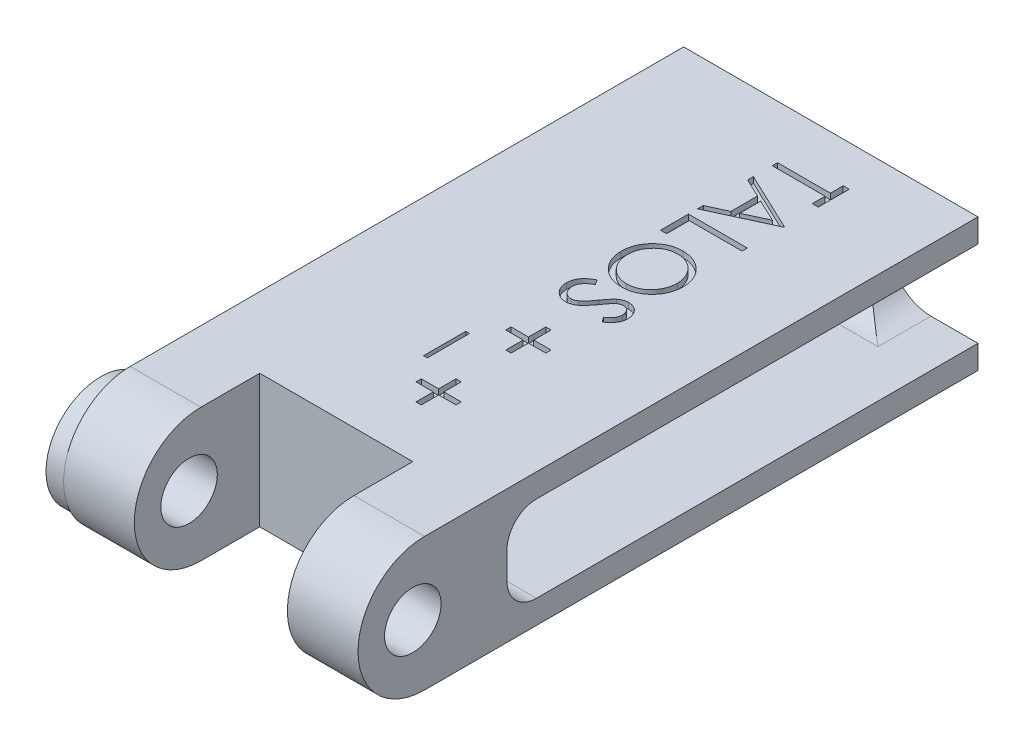
from build123d import *

# Parameters (mm, degrees)
SKETCH1_W           = 20
SKETCH1_H           = 14.6
SKETCH1_R           = 1.65
BOSS_EXTRUDE1_DEPTH = 4
SKETCH2_W           = 50
SKETCH2_H           = 80
BOSS_EXTRUDE2_DEPTH = 4
CHAMFER1_SIZE       = 10
MIRROR1_OUTLINE_W   = 50
MIRROR1_OUTLINE_H   = 4
MIRROR1_DEPTH       = 80
MIRROR1_2_DEPTH     = 4
SKETCH3_W           = 50
SKETCH3_H           = 22.6
BOSS_EXTRUDE3_DEPTH = 4
SKETCH7_R           = 4.8
BOSS_EXTRUDE5_DEPTH = 12
SKETCH8_R           = 9.3
BOSS_EXTRUDE6_DEPTH = 3
SKETCH9_R           = 2.4
BOSS_EXTRUDE7_DEPTH = 4.2
CUT_EXTRUDE2_DEPTH  = 12
FILLET1_R           = 7
FILLET2_R           = 5
FILLET3_R           = 5
SKETCH12_W          = 0.641025641
SKETCH12_H          = 7.17948718
CUT_EXTRUDE3_DEPTH  = 1


# Read off the part's stored shape, not the designer's step: Mirror1
with BuildPart() as part:
    # Sketch1 → Boss-Extrude1 (new body)
    with BuildSketch(Plane.XY):
        Rectangle(SKETCH1_W, SKETCH1_H)
        with Locations((-6, 0)):
            Circle(SKETCH1_R, mode=Mode.SUBTRACT)
        with Locations((6, 0)):
            Circle(SKETCH1_R, mode=Mode.SUBTRACT)
    extrude(amount=BOSS_EXTRUDE1_DEPTH)

    # Sketch2 → Boss-Extrude2 (add)
    with BuildSketch(Plane.XZ.offset(7.3)):
        with Locations((0, 40)):
            Rectangle(SKETCH2_W, SKETCH2_H)
    extrude(amount=BOSS_EXTRUDE2_DEPTH)

    # Chamfer1
    chamfer1_edges = [part.edges().sort_by_distance(p)[0] for p in [
        (10, -7.3, 2),
        (-10, -7.3, 2),
    ]]
    chamfer(chamfer1_edges, length=CHAMFER1_SIZE)

    # Mirror1 outline → Mirror1 (add)
    with BuildSketch(Plane.XY):
        with Locations((0, 9.3)):
            Rectangle(MIRROR1_OUTLINE_W, MIRROR1_OUTLINE_H)
    extrude(amount=MIRROR1_DEPTH)

    # Mirror1 2 outline → Mirror1 2 (add)
    with BuildSketch(Plane.XY):
        Polygon((-10, 7.3), (-20, 7.3), (-12.7, 0), (-10, 2.7), align=None)
        Polygon((12.7, 0), (20, 7.3), (10, 7.3), (10, 2.7), align=None)
    extrude(amount=MIRROR1_2_DEPTH)

    # Sketch3 → Boss-Extrude3 (add)
    with BuildSketch(Plane.XY.offset(80)):
        Rectangle(SKETCH3_W, SKETCH3_H)
    extrude(amount=BOSS_EXTRUDE3_DEPTH)

    # Sketch7 → Boss-Extrude5 (add)
    with BuildSketch(Plane(origin=(25, 0, 0), x_dir=(0, 0, -1), z_dir=(1, 0, 0))):
        with BuildLine():
            Line((-84, 11.3), (-94, 11.3))
            ThreePointArc((-94, 11.3), (-105.3, 0), (-94, -11.3))
            Line((-94, -11.3), (-84, -11.3))
            Line((-84, -11.3), (-84, 11.3))
        make_face()
        with Locations((-96, 0)):
            Circle(SKETCH7_R, mode=Mode.SUBTRACT)
    boss_extrude5 = extrude(amount=-BOSS_EXTRUDE5_DEPTH)

    # Mirror2: Boss-Extrude5 across plane
    add(boss_extrude5.mirror(Plane(origin=(0, 0, 0), x_dir=(0, 0, 1), z_dir=(1, 0, 0))))

    # Sketch8 → Boss-Extrude6 (add)
    with BuildSketch(Plane.ZY.offset(25)):
        with Locations(Location((96, 0, 0), (0, 0, 359.999368251))):
            Circle(SKETCH8_R)
    extrude(amount=BOSS_EXTRUDE6_DEPTH)

    # Sketch9 → Boss-Extrude7 (add)
    with BuildSketch(Plane.ZY.offset(28)):
        with Locations((96, 0)):
            Circle(SKETCH9_R)
    extrude(amount=BOSS_EXTRUDE7_DEPTH)

    # Sketch11 → Cut-Extrude2 (cut)
    with BuildSketch(Plane(origin=(0, 0, 0), x_dir=(-1, 0, 0), z_dir=(0, 0, -1))):
        Polygon((-10, -7.3), (-10, 7.3), (-20, 7.3), (-12.7, 0), (-20, -7.3), align=None)
        Polygon((20, 7.3), (10, 7.3), (10, -7.3), (20, -7.3), (12.7, 0), align=None)
    extrude(amount=-CUT_EXTRUDE2_DEPTH, mode=Mode.SUBTRACT)

    # Fillet1
    fillet1_edges = [part.edges().sort_by_distance(p)[0] for p in [
        (10, 7.3, 2),
        (10, -7.3, 2),
        (-10, 7.3, 2),
        (-10, -7.3, 2),
    ]]
    fillet(fillet1_edges, radius=FILLET1_R)

    # Fillet2
    fillet2_edges = [part.edges().sort_by_distance(p)[0] for p in [
        (0, 7.3, 4),
        (0, -7.3, 4),
    ]]
    fillet(fillet2_edges, radius=FILLET2_R)

    # Fillet3
    fillet3_edges = [part.edges().sort_by_distance(p)[0] for p in [
        (0, -7.3, 80),
        (0, 7.3, 80),
    ]]
    fillet(fillet3_edges, radius=FILLET3_R)

    # Sketch12 → Cut-Extrude3 (cut)
    # profile 1 of 8: a face of its own
    with BuildSketch(Plane(origin=(0, 11.3, 0), x_dir=(1, 0, 0), z_dir=(0, 1, 0))):
        Polygon((8.974358974, -6.869589227), (10, -6.869589227), (10, -12.125999483), (8.974358974, -12.125999483), (8.974358974, -9.946512304), (0, -9.946512304), (0, -9.049076406), (8.974358974, -9.049076406), align=None)
    # profile 2 of 8: a face of its own
    with BuildSketch(Plane(origin=(0, 11.3, 0), x_dir=(1, 0, 0), z_dir=(0, 1, 0))):
        Polygon((10, -18.023435381), (0, -22.638819996), (0, -21.663259099), (3.205128205, -20.184893714), (3.205128205, -15.651640509), (0, -14.133211022), (0, -13.151640509), (10, -17.895230252), align=None)
        Polygon((8.048878205, -17.949316791), (4.230769231, -16.14042256), (4.230769231, -19.712137304), align=None, mode=Mode.SUBTRACT)
    # profile 3 of 8: a face of its own
    with BuildSketch(Plane(origin=(0, 11.3, 0), x_dir=(1, 0, 0), z_dir=(0, 1, 0))):
        Polygon((10, -24.177281535), (10, -25.074717432), (1.025641026, -25.074717432), (1.025641026, -28.920871278), (0, -28.920871278), (0, -24.177281535), align=None)
    # profile 4 of 8: a face of its own
    with BuildSketch(Plane(origin=(0, 11.3, 0), x_dir=(1, 0, 0), z_dir=(0, 1, 0))):
        with BuildLine():
            add(Edge.make_bspline(
                [(10.256410256, -35.267025124), (10.251720273, -35.452191104), (10.242508758, -35.815872365), (10.17199764, -36.350372602), (10.050008587, -36.860642363), (9.887551039, -37.350849835), (9.670794245, -37.815089351), (9.408949056, -38.257012712), (9.098291416, -38.675370431), (8.744034019, -39.066327757), (8.357182497, -39.422777414), (7.943152065, -39.734205023), (7.507612223, -39.997514714), (7.049047409, -40.213331205), (6.569475928, -40.382794384), (6.066171026, -40.499695417), (5.542439743, -40.574378721), (5.185219838, -40.583109118), (5.00400641, -40.587537945)],
                knots=[0, 0, 0, 0, 1.06508495, 2.091914715, 3.094501328, 4.079693967, 5.057647778, 6.035986298, 7.030177474, 8.050107388, 9.066943579, 10.051896531, 11.025616101, 11.9896488, 12.96281505, 13.945825876, 14.957941789, 16, 16, 16, 16], degree=3))
            add(Edge.make_bspline(
                [(5.00400641, -40.587537945), (4.824127837, -40.583109774), (4.46956633, -40.574381337), (3.949158714, -40.499610417), (3.448891415, -40.382361374), (2.969648141, -40.21490319), (2.510743141, -40.000123482), (2.074402732, -39.735034201), (1.657505512, -39.425668444), (1.268776002, -39.070450824), (0.911626105, -38.683691556), (0.599714309, -38.268493588), (0.333162649, -37.833382382), (0.118826425, -37.375094779), (-0.051836088, -36.898739926), (-0.168303261, -36.399952048), (-0.243400628, -35.880956782), (-0.252026128, -35.527040333), (-0.256410256, -35.347153329)],
                knots=[0, 0, 0, 0, 1.04355943, 2.056976533, 3.044937463, 4.02179873, 4.997890911, 5.980248884, 6.980147982, 8.006253959, 9.032111064, 10.031228745, 11.015595249, 11.988180414, 12.962670953, 13.946861971, 14.95644057, 16, 16, 16, 16], degree=3))
            add(Edge.make_bspline(
                [(-0.256410256, -35.347153329), (-0.251984031, -35.165940635), (-0.243258762, -34.808722177), (-0.16844623, -34.284335728), (-0.051502314, -33.7806664), (0.115781777, -33.299264982), (0.331162929, -32.8399735), (0.59583438, -32.402836374), (0.907713335, -31.987328314), (1.262458028, -31.597677596), (1.649403169, -31.241589515), (2.061872021, -30.928389484), (2.495941769, -30.66524392), (2.949823096, -30.449771846), (3.422342797, -30.279341639), (3.916473197, -30.163031388), (4.429445413, -30.087788733), (4.778710535, -30.079117341), (4.955929487, -30.074717432)],
                knots=[0, 0, 0, 0, 1.053167129, 2.076072758, 3.073341244, 4.055601477, 5.033424535, 6.017524495, 7.021518915, 8.049444456, 9.077120685, 10.074910483, 11.055688766, 12.022980584, 12.991883888, 13.970269434, 14.970104079, 16, 16, 16, 16], degree=3))
            add(Edge.make_bspline(
                [(4.955929487, -30.074717432), (5.074880514, -30.076243561), (5.311281947, -30.079276567), (5.662321377, -30.115844869), (6.007753236, -30.16880106), (6.346416349, -30.245092575), (6.678366018, -30.343502158), (7.002923388, -30.464775273), (7.322761859, -30.60375431), (7.631794336, -30.769228051), (7.930505869, -30.949764855), (8.215161318, -31.1466221), (8.480675968, -31.361172367), (8.731316214, -31.590350856), (8.962804196, -31.837329911), (9.180186887, -32.098392504), (9.38121402, -32.374904633), (9.561663472, -32.66730361), (9.727408486, -32.968134611), (9.865791933, -33.27958018), (9.988104342, -33.595069129), (10.085306436, -33.917380408), (10.162660442, -34.245768458), (10.215220535, -34.580643799), (10.25187009, -34.921661515), (10.254890356, -35.151408613), (10.256410256, -35.267025124)],
                knots=[0, 0, 0, 0, 1.037115869, 2.061148057, 3.07517727, 4.084041727, 5.086514338, 6.092668487, 7.104487461, 8.125783165, 9.147610153, 10.147694368, 11.141876323, 12.122903372, 13.107606018, 14.091946891, 15.084523921, 16.086505767, 17.087268121, 18.077809654, 19.05670789, 20.036870126, 21.011670792, 21.99694167, 22.991993299, 24, 24, 24, 24], degree=3))
        make_face()
        with BuildLine():
            add(Edge.make_bspline(
                [(9.230769231, -35.311095637), (9.229612952, -35.216196467), (9.227311449, -35.027305371), (9.196972691, -34.746495613), (9.153775095, -34.469363743), (9.091999222, -34.195924841), (9.008604034, -33.927650388), (8.910340594, -33.661861298), (8.794748549, -33.399833798), (8.659965346, -33.144497168), (8.512729335, -32.896278204), (8.351132709, -32.660449536), (8.175959042, -32.439363715), (7.989522262, -32.232312523), (7.789925445, -32.039899303), (7.580354173, -31.85822371), (7.354775423, -31.694597687), (7.119317636, -31.544638531), (6.874284408, -31.410444799), (6.622256267, -31.291115188), (6.361177152, -31.193503741), (6.093879562, -31.11389695), (5.820786819, -31.047897491), (5.539827251, -31.006086279), (5.252412645, -30.975422395), (5.058178777, -30.973251408), (4.959935897, -30.972153329)],
                knots=[0, 0, 0, 0, 1.008585988, 2.007529826, 2.999688727, 3.990042337, 4.984966365, 5.984641633, 7.001812546, 8.027570247, 9.052811818, 10.068991095, 11.064725446, 12.050001529, 13.029093193, 14.010961114, 14.996492974, 15.989185205, 16.977398719, 17.96520407, 18.951579521, 19.937648295, 20.929603947, 21.935788061, 22.955928099, 24, 24, 24, 24], degree=3))
            add(Edge.make_bspline(
                [(4.959935897, -30.972153329), (4.815472409, -30.975795792), (4.531268037, -30.982961643), (4.114787626, -31.045697558), (3.714535379, -31.14233177), (3.332701353, -31.284781389), (2.966003402, -31.462926002), (2.617694531, -31.683002832), (2.287680605, -31.943743076), (1.97826555, -32.239924581), (1.695848967, -32.563703742), (1.447953514, -32.907511542), (1.238209943, -33.267664706), (1.067338307, -33.645102428), (0.931939056, -34.037809683), (0.839142968, -34.448316971), (0.778070238, -34.873889713), (0.772205221, -35.163977299), (0.769230769, -35.311095637)],
                knots=[0, 0, 0, 0, 1.032063989, 2.030389145, 3.003944642, 3.970395727, 4.937377036, 5.913328081, 6.909231446, 7.93887556, 8.970685674, 9.976071282, 10.964166581, 11.944589148, 12.933237628, 13.927779006, 14.949070134, 16, 16, 16, 16], degree=3))
            add(Edge.make_bspline(
                [(0.769230769, -35.311095637), (0.770589349, -35.40997993), (0.773283821, -35.606097183), (0.800422957, -35.897798634), (0.843942363, -36.184245108), (0.906602193, -36.465033906), (0.985019773, -36.739849772), (1.078195918, -37.009827032), (1.19438572, -37.27213758), (1.322967657, -37.529910728), (1.468497551, -37.776695799), (1.627835379, -38.010834865), (1.799876257, -38.230970527), (1.984694048, -38.437579584), (2.180695571, -38.631326012), (2.39292035, -38.806948782), (2.615170446, -38.972535019), (2.851177439, -39.121893722), (3.096727022, -39.255820653), (3.349709813, -39.372278425), (3.609256397, -39.471138823), (3.875806673, -39.550930685), (4.148836878, -39.613461619), (4.428717316, -39.656546821), (4.714886808, -39.686685294), (4.908440691, -39.688956933), (5.006009615, -39.690102047)],
                knots=[0, 0, 0, 0, 1.047226202, 2.076964084, 3.100341814, 4.114585567, 5.122123135, 6.126552355, 7.137064942, 8.158803602, 9.176592812, 10.169297945, 11.156925011, 12.133779169, 13.104132798, 14.073170763, 15.049307625, 16.038276215, 17.028988595, 18.010110019, 18.986169996, 19.968539974, 20.955178716, 21.950601663, 22.966915103, 24, 24, 24, 24], degree=3))
            add(Edge.make_bspline(
                [(5.006009615, -39.690102047), (5.102911056, -39.68895601), (5.295132914, -39.686682635), (5.579306681, -39.656561279), (5.857172999, -39.613415877), (6.127641008, -39.551236712), (6.390779651, -39.471093415), (6.646341787, -39.372272471), (6.895279487, -39.255743044), (7.136977478, -39.12200526), (7.368905302, -38.971674336), (7.590626479, -38.807405069), (7.797977175, -38.626361219), (7.996076274, -38.433715426), (8.180698919, -38.224655783), (8.351905726, -38.000129116), (8.513830873, -37.762861896), (8.659898137, -37.511639572), (8.794817546, -37.252377315), (8.910312287, -36.986314667), (9.009029008, -36.715999598), (9.091657869, -36.442816108), (9.153835618, -36.164839729), (9.196957192, -35.883689235), (9.227314698, -35.598884068), (9.229614066, -35.407329531), (9.230769231, -35.311095637)],
                knots=[0, 0, 0, 0, 1.029967493, 2.04313025, 3.035375922, 4.01889446, 4.991458755, 5.958017022, 6.930036849, 7.912118993, 8.892942568, 9.867138445, 10.843712051, 11.817804417, 12.803729339, 13.806387533, 14.818654169, 15.856205545, 16.894655496, 17.924916651, 18.938004761, 19.953404357, 20.957695443, 21.963967554, 22.97713031, 24, 24, 24, 24], degree=3))
        make_face(mode=Mode.SUBTRACT)
    # profile 5 of 8: a face of its own
    with BuildSketch(Plane(origin=(0, 11.3, 0), x_dir=(1, 0, 0), z_dir=(0, 1, 0))):
        with BuildLine():
            Line((1.929086538, -41.61317897), (2.435897436, -42.458531535))
            add(Edge.make_bspline(
                [(2.435897436, -42.458531535), (2.304284907, -42.53715507), (2.052120382, -42.687794728), (1.711383124, -42.939084326), (1.421776961, -43.199464072), (1.184986654, -43.470862168), (0.998561264, -43.75162202), (0.866554887, -44.043576459), (0.784223529, -44.345741633), (0.774223282, -44.551381122), (0.769230769, -44.654044355)],
                knots=[0, 0, 0, 0, 1.272034388, 2.437168799, 3.508375237, 4.49857839, 5.41946034, 6.295179144, 7.148887113, 8, 8, 8, 8], degree=3))
            add(Edge.make_bspline(
                [(0.769230769, -44.654044355), (0.771672688, -44.741721108), (0.776513797, -44.915540478), (0.823030419, -45.171432468), (0.894493475, -45.419952403), (0.996839627, -45.65597521), (1.120661585, -45.876255158), (1.270230127, -46.069393375), (1.437647918, -46.23646662), (1.624559192, -46.37275732), (1.8248818, -46.478560674), (2.032342831, -46.555122909), (2.246029729, -46.603850166), (2.390902996, -46.610052169), (2.463942308, -46.61317897)],
                knots=[0, 0, 0, 0, 1.095270387, 2.171376115, 3.241375676, 4.322296363, 5.380636668, 6.392615365, 7.366724986, 8.328592944, 9.273498763, 10.190095884, 11.087518669, 12, 12, 12, 12], degree=3))
            add(Edge.make_bspline(
                [(2.463942308, -46.61317897), (2.547201878, -46.608966654), (2.716456419, -46.600403631), (2.966169713, -46.528027973), (3.213291342, -46.414172982), (3.3661521, -46.309136857), (3.445512821, -46.254605252)],
                knots=[0, 0, 0, 0, 0.938893495, 1.908633276, 2.914225137, 4, 4, 4, 4], degree=3))
            add(Edge.make_bspline(
                [(3.445512821, -46.254605252), (3.502906547, -46.209958821), (3.623751181, -46.115954091), (3.800623953, -45.952106412), (3.98752636, -45.76484435), (4.183699434, -45.553231733), (4.385560567, -45.31306214), (4.597317573, -45.049267163), (4.818334044, -44.760481243), (4.964490078, -44.556957977), (5.040064103, -44.451720637)],
                knots=[0, 0, 0, 0, 0.72226686, 1.520759855, 2.393439377, 3.351307446, 4.386958158, 5.510256019, 6.712608938, 8, 8, 8, 8], degree=3))
            add(Edge.make_bspline(
                [(5.040064103, -44.451720637), (5.115020077, -44.346523253), (5.258330192, -44.145393867), (5.470749255, -43.863902198), (5.666198263, -43.61252417), (5.841954683, -43.389978886), (6.005684121, -43.202023874), (6.148611593, -43.041788025), (6.278369262, -42.915183046), (6.362477748, -42.844730361), (6.400240385, -42.813098842)],
                knots=[0, 0, 0, 0, 1.452255772, 2.776602448, 3.96446981, 5.032613149, 5.964194703, 6.766668629, 7.446264616, 8, 8, 8, 8], degree=3))
            add(Edge.make_bspline(
                [(6.400240385, -42.813098842), (6.45910049, -42.76889157), (6.574856786, -42.681952037), (6.755784951, -42.567192021), (6.940994281, -42.469651556), (7.130982466, -42.39318775), (7.323082262, -42.328798553), (7.519800107, -42.28549018), (7.720253303, -42.258371903), (7.855149019, -42.255594798), (7.922676282, -42.254204611)],
                knots=[0, 0, 0, 0, 1.068054152, 2.10047183, 3.106115577, 4.101338837, 5.06977816, 6.043150881, 7.020423561, 8, 8, 8, 8], degree=3))
            add(Edge.make_bspline(
                [(7.922676282, -42.254204611), (8.028484496, -42.257917513), (8.237839349, -42.265263955), (8.543513198, -42.327901445), (8.836240705, -42.425611789), (9.109573973, -42.566929555), (9.362873811, -42.74165064), (9.59227021, -42.948143517), (9.786758581, -43.193308356), (9.954716197, -43.463801452), (10.087325758, -43.757966301), (10.187890317, -44.065663395), (10.244112064, -44.388241998), (10.25227058, -44.607098102), (10.256410256, -44.718146919)],
                knots=[0, 0, 0, 0, 1.005541892, 1.989591032, 2.955705311, 3.932863626, 4.905387107, 5.876519979, 6.856563935, 7.871847665, 8.897921447, 9.918317993, 10.943742853, 12, 12, 12, 12], degree=3))
            add(Edge.make_bspline(
                [(10.256410256, -44.718146919), (10.252421961, -44.836004771), (10.244512693, -45.069730985), (10.173281219, -45.414176834), (10.058219835, -45.746444752), (9.925697029, -46.013904145), (9.793931624, -46.222867363), (9.673866426, -46.382215266), (9.535654372, -46.543694517), (9.378912918, -46.708603003), (9.202208136, -46.874147815), (9.00674896, -47.042786229), (8.793730248, -47.214912718), (8.641660243, -47.325643746), (8.563701923, -47.38240974)],
                knots=[0, 0, 0, 0, 1.286821612, 2.551921131, 3.825787379, 5.12137259, 5.803616487, 6.523126609, 7.299589446, 8.125436757, 9.008162487, 9.944516264, 10.946261234, 12, 12, 12, 12], degree=3))
            Line((8.563701923, -47.38240974), (7.948717949, -46.571111663))
            add(Edge.make_bspline(
                [(7.948717949, -46.571111663), (8.011828495, -46.522123285), (8.13336465, -46.427783123), (8.303568386, -46.28455601), (8.45904412, -46.149559898), (8.594087082, -46.016558673), (8.716094031, -45.892577141), (8.820547674, -45.772241841), (8.908487056, -45.657289452), (9.002287774, -45.512371886), (9.095860932, -45.329841708), (9.173355481, -45.100939558), (9.221601238, -44.862382172), (9.22767964, -44.700347344), (9.230769231, -44.617986663)],
                knots=[0, 0, 0, 0, 1.181667846, 2.275615987, 3.290305621, 4.226321945, 5.078535498, 5.862783384, 6.581873284, 7.217493746, 8.414623899, 9.604724551, 10.782505457, 12, 12, 12, 12], degree=3))
            add(Edge.make_bspline(
                [(9.230769231, -44.617986663), (9.227307231, -44.514682313), (9.22063109, -44.315469606), (9.147716847, -44.03264036), (9.032911531, -43.778086288), (8.872011594, -43.559364674), (8.681380186, -43.377259025), (8.462012029, -43.245529143), (8.219776593, -43.166242959), (8.050800432, -43.156567874), (7.96474359, -43.151640509)],
                knots=[0, 0, 0, 0, 1.14458467, 2.207223713, 3.21896685, 4.227309161, 5.202851033, 6.127160689, 7.046193047, 8, 8, 8, 8], degree=3))
            add(Edge.make_bspline(
                [(7.96474359, -43.151640509), (7.911181596, -43.152816018), (7.803970024, -43.155168958), (7.645156774, -43.185771453), (7.487753253, -43.229164872), (7.331059554, -43.292673813), (7.171389336, -43.378217504), (7.009173691, -43.494531209), (6.840317064, -43.640044442), (6.730602347, -43.751728943), (6.672676282, -43.810694996)],
                knots=[0, 0, 0, 0, 0.858526328, 1.718456515, 2.587092892, 3.476767204, 4.426280253, 5.487868114, 6.673670035, 8, 8, 8, 8], degree=3))
            add(Edge.make_bspline(
                [(6.672676282, -43.810694996), (6.653141923, -43.832584631), (6.606732756, -43.884589395), (6.530754811, -43.979663468), (6.437032605, -44.10521432), (6.321068843, -44.257963467), (6.18655038, -44.440727357), (6.035197203, -44.653526089), (5.862095891, -44.893987611), (5.741074346, -45.064621657), (5.677083333, -45.154845637)],
                knots=[0, 0, 0, 0, 0.420754252, 0.999615792, 1.744751191, 2.668019286, 3.750313428, 4.999500688, 6.413464383, 8, 8, 8, 8], degree=3))
            add(Edge.make_bspline(
                [(5.677083333, -45.154845637), (5.59810802, -45.263376818), (5.445183272, -45.473532408), (5.215424187, -45.772554064), (4.990716276, -46.04367923), (4.772494542, -46.287859812), (4.562414276, -46.507508122), (4.357948047, -46.700187324), (4.160560696, -46.867860696), (3.907496194, -47.048372749), (3.596693096, -47.232823662), (3.215898129, -47.391227969), (2.833622928, -47.491108962), (2.576689109, -47.504170434), (2.449919872, -47.510614868)],
                knots=[0, 0, 0, 0, 1.163667725, 2.253281268, 3.268753668, 4.215851969, 5.092017293, 5.902905408, 6.650798638, 7.335211899, 8.59617414, 9.77448103, 10.901945474, 12, 12, 12, 12], degree=3))
            add(Edge.make_bspline(
                [(2.449919872, -47.510614868), (2.360268107, -47.508736287), (2.182705554, -47.505015607), (1.921966485, -47.462285306), (1.668773652, -47.399601284), (1.426027324, -47.305420437), (1.190479353, -47.1895691), (0.964299469, -47.04647607), (0.750596939, -46.873977514), (0.544924634, -46.682252355), (0.359143413, -46.469181981), (0.192982918, -46.244519661), (0.053907628, -46.006806865), (-0.058048339, -45.757194148), (-0.146997935, -45.497062317), (-0.210933045, -45.226137613), (-0.250262657, -44.943665591), (-0.25433818, -44.751662523), (-0.256410256, -44.654044355)],
                knots=[0, 0, 0, 0, 0.983610584, 1.948120116, 2.894308362, 3.843560551, 4.801159957, 5.773581695, 6.77566113, 7.813174769, 8.857584665, 9.875476876, 10.877851407, 11.875574773, 12.875048225, 13.892438445, 14.928473903, 16, 16, 16, 16], degree=3))
            add(Edge.make_bspline(
                [(-0.256410256, -44.654044355), (-0.254933002, -44.578518137), (-0.251997099, -44.428416876), (-0.226656723, -44.206994883), (-0.189494754, -43.98963887), (-0.132836211, -43.779078004), (-0.062475299, -43.572690418), (0.023671457, -43.372315789), (0.126224791, -43.177467296), (0.245354565, -42.987917412), (0.382647432, -42.801880029), (0.541309341, -42.62030891), (0.720244382, -42.441126864), (0.921287576, -42.267618574), (1.142290981, -42.096585831), (1.38510639, -41.931209294), (1.648473334, -41.768121414), (1.833801715, -41.665791118), (1.929086538, -41.61317897)],
                knots=[0, 0, 0, 0, 0.915384692, 1.819241058, 2.699029451, 3.586605375, 4.459625921, 5.340865773, 6.228072412, 7.126546901, 8.052715223, 9.028303326, 10.047266019, 11.120332924, 12.245748783, 13.433636234, 14.680528497, 16, 16, 16, 16], degree=3))
        make_face()
    # profile 6 of 8: a face of its own
    with BuildSketch(Plane(origin=(0, 11.3, 0), x_dir=(1, 0, 0), z_dir=(0, 1, 0))):
        Polygon((5.384615385, -55.843948201), (8.333333333, -55.843948201), (8.333333333, -56.741384099), (5.384615385, -56.741384099), (5.384615385, -59.690102047), (4.487179487, -59.690102047), (4.487179487, -56.741384099), (1.538461538, -56.741384099), (1.538461538, -55.843948201), (4.487179487, -55.843948201), (4.487179487, -52.895230252), (5.384615385, -52.895230252), align=None)
    # profile 7 of 8: a face of its own
    with BuildSketch(Plane(origin=(0, 11.3, 0), x_dir=(1, 0, 0), z_dir=(0, 1, 0))):
        with Locations((-1.346153847, -63.920871278)):
            Rectangle(SKETCH12_W, SKETCH12_H)
    # profile 8 of 8: a face of its own
    with BuildSketch(Plane(origin=(0, 11.3, 0), x_dir=(1, 0, 0), z_dir=(0, 1, 0))):
        Polygon((5.384615385, -71.100358458), (8.333333333, -71.100358458), (8.333333333, -71.997794355), (5.384615385, -71.997794355), (5.384615385, -74.946512304), (4.487179487, -74.946512304), (4.487179487, -71.997794355), (1.538461538, -71.997794355), (1.538461538, -71.100358458), (4.487179487, -71.100358458), (4.487179487, -68.151640509), (5.384615385, -68.151640509), align=None)
    extrude(amount=-CUT_EXTRUDE3_DEPTH, mode=Mode.SUBTRACT)


solid = part.part
